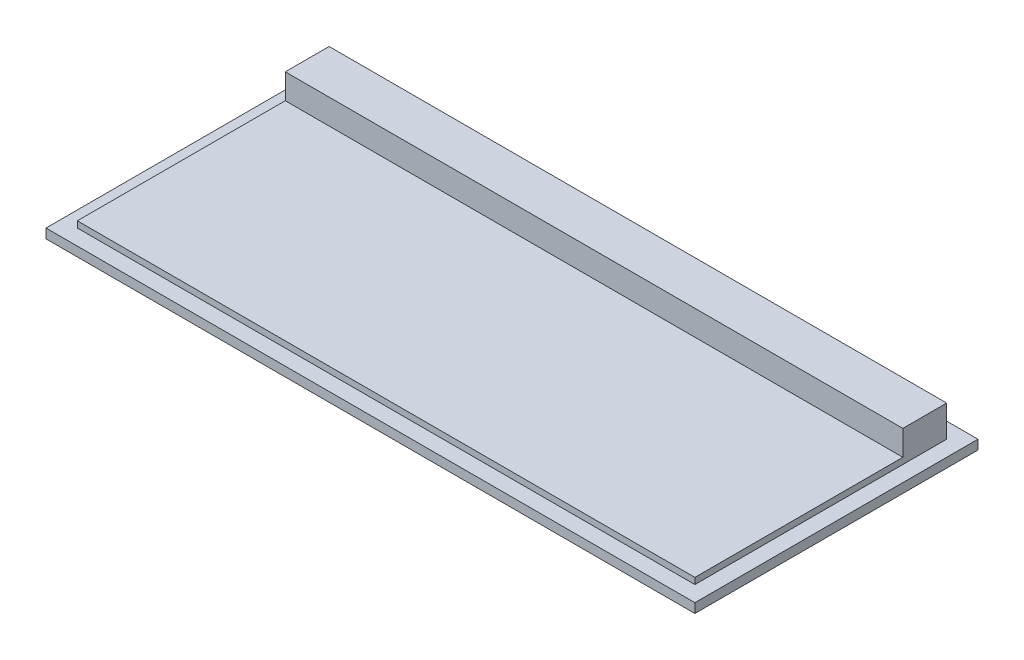
from build123d import *

# Parameters (mm, degrees)
SKETCH1_W           = 114.808
SKETCH1_H           = 3.81
BOSS_EXTRUDE1_DEPTH = 263.144
SKETCH2_W           = 250.444
SKETCH2_H           = 102.108
BOSS_EXTRUDE2_DEPTH = 2.54
SKETCH3_W           = 17.78
SKETCH3_H           = 10.16
BOSS_EXTRUDE3_DEPTH = 250.444
SKETCH4_W           = 12.7
SKETCH4_H           = 7.62
SKETCH4_W_2         = 11.176
SKETCH4_H_2         = 2.20281073
CUT_EXTRUDE2_DEPTH  = 12.7
SKETCH6_W           = 9.581222359
SKETCH6_H           = 1.422212694
BOSS_EXTRUDE4_DEPTH = 0.254
BOSS_EXTRUDE5_DEPTH = 1.27


with BuildPart() as part:
    # Sketch1 → Boss-Extrude1 (new body)
    with BuildSketch(Plane(origin=(0, 0, 0), x_dir=(0, 0, -1), z_dir=(1, 0, 0))):
        with Locations((57.404, 1.905)):
            Rectangle(SKETCH1_W, SKETCH1_H)
    extrude(amount=BOSS_EXTRUDE1_DEPTH)

    # Sketch2 → Boss-Extrude2 (add)
    with BuildSketch(Plane(origin=(0, 3.81, 0), x_dir=(1, 0, 0), z_dir=(0, 1, 0))):
        with Locations((131.572, 57.404)):
            Rectangle(SKETCH2_W, SKETCH2_H)
    extrude(amount=BOSS_EXTRUDE2_DEPTH)

    # Sketch3 → Boss-Extrude3 (add)
    with BuildSketch(Plane.ZY.offset(-6.35)):
        with Locations((-99.568, 11.43)):
            Rectangle(SKETCH3_W, SKETCH3_H)
    extrude(amount=-BOSS_EXTRUDE3_DEPTH)

    # Sketch4 → Cut-Extrude2 (cut)
    with BuildSketch(Plane.ZY.offset(-6.35)):
        with Locations((-99.568, 10.16)):
            Rectangle(SKETCH4_W, SKETCH4_H)
        with Locations((-99.568, 8.213405365)):
            Rectangle(SKETCH4_W_2, SKETCH4_H_2, mode=Mode.SUBTRACT)
    extrude(amount=-CUT_EXTRUDE2_DEPTH, mode=Mode.SUBTRACT)

    # Sketch6 → Boss-Extrude4 (add)
    with BuildSketch(Plane(origin=(0, 9.31481073, 0), x_dir=(1, 0, 0), z_dir=(0, 1, 0))):
        with Locations((12.657964299, 99.7444563)):
            Rectangle(SKETCH6_W, SKETCH6_H)
        with Locations((12.657964299, 102.5384563)):
            Rectangle(SKETCH6_W, SKETCH6_H)
        with Locations((12.657964299, 96.9504563)):
            Rectangle(SKETCH6_W, SKETCH6_H)
    extrude(amount=BOSS_EXTRUDE4_DEPTH)

    # Sketch7 → Boss-Extrude5 (add)
    with BuildSketch(Plane.XZ):
        with BuildLine():
            ThreePointArc((29.540645446, -103.040229749), (28.642619834, -103.412204137), (28.270645446, -104.310229749))
            Line((28.270645446, -104.310229749), (28.270645446, -109.036079669))
            ThreePointArc((28.270645446, -109.036079669), (28.642619834, -109.934105281), (29.540645446, -110.306079669))
            Line((29.540645446, -110.306079669), (41.281798737, -110.306079669))
            ThreePointArc((41.281798737, -110.306079669), (42.179824349, -109.934105281), (42.551798737, -109.036079669))
            Line((42.551798737, -109.036079669), (42.551798737, -104.310229749))
            ThreePointArc((42.551798737, -104.310229749), (42.179824349, -103.412204137), (41.281798737, -103.040229749))
            Line((41.281798737, -103.040229749), (29.540645446, -103.040229749))
        make_face()
        with BuildLine():
            Line((23.501798737, -103.040229749), (11.760645446, -103.040229749))
            ThreePointArc((11.760645446, -103.040229749), (10.862619834, -103.412204137), (10.490645446, -104.310229749))
            Line((10.490645446, -104.310229749), (10.490645446, -109.036079669))
            ThreePointArc((10.490645446, -109.036079669), (10.862619834, -109.934105281), (11.760645446, -110.306079669))
            Line((11.760645446, -110.306079669), (23.501798737, -110.306079669))
            ThreePointArc((23.501798737, -110.306079669), (24.399824349, -109.934105281), (24.771798737, -109.036079669))
            Line((24.771798737, -109.036079669), (24.771798737, -104.310229749))
            ThreePointArc((24.771798737, -104.310229749), (24.399824349, -103.412204137), (23.501798737, -103.040229749))
        make_face()
        with BuildLine():
            ThreePointArc((47.320645446, -103.040229749), (46.422619834, -103.412204137), (46.050645446, -104.310229749))
            Line((46.050645446, -104.310229749), (46.050645446, -109.036079669))
            ThreePointArc((46.050645446, -109.036079669), (46.422619834, -109.934105281), (47.320645446, -110.306079669))
            Line((47.320645446, -110.306079669), (59.061798737, -110.306079669))
            ThreePointArc((59.061798737, -110.306079669), (59.959824349, -109.934105281), (60.331798737, -109.036079669))
            Line((60.331798737, -109.036079669), (60.331798737, -104.310229749))
            ThreePointArc((60.331798737, -104.310229749), (59.959824349, -103.412204137), (59.061798737, -103.040229749))
            Line((59.061798737, -103.040229749), (47.320645446, -103.040229749))
        make_face()
        with BuildLine():
            ThreePointArc((65.100645446, -103.040229749), (64.202619834, -103.412204137), (63.830645446, -104.310229749))
            Line((63.830645446, -104.310229749), (63.830645446, -109.036079669))
            ThreePointArc((63.830645446, -109.036079669), (64.202619834, -109.934105281), (65.100645446, -110.306079669))
            Line((65.100645446, -110.306079669), (76.841798737, -110.306079669))
            ThreePointArc((76.841798737, -110.306079669), (77.739824349, -109.934105281), (78.111798737, -109.036079669))
            Line((78.111798737, -109.036079669), (78.111798737, -104.310229749))
            ThreePointArc((78.111798737, -104.310229749), (77.739824349, -103.412204137), (76.841798737, -103.040229749))
            Line((76.841798737, -103.040229749), (65.100645446, -103.040229749))
        make_face()
        with BuildLine():
            ThreePointArc((82.880645446, -103.040229749), (81.982619834, -103.412204137), (81.610645446, -104.310229749))
            Line((81.610645446, -104.310229749), (81.610645446, -109.036079669))
            ThreePointArc((81.610645446, -109.036079669), (81.982619834, -109.934105281), (82.880645446, -110.306079669))
            Line((82.880645446, -110.306079669), (94.621798737, -110.306079669))
            ThreePointArc((94.621798737, -110.306079669), (95.519824349, -109.934105281), (95.891798737, -109.036079669))
            Line((95.891798737, -109.036079669), (95.891798737, -104.310229749))
            ThreePointArc((95.891798737, -104.310229749), (95.519824349, -103.412204137), (94.621798737, -103.040229749))
            Line((94.621798737, -103.040229749), (82.880645446, -103.040229749))
        make_face()
        with BuildLine():
            ThreePointArc((100.660645446, -103.040229749), (99.762619834, -103.412204137), (99.390645446, -104.310229749))
            Line((99.390645446, -104.310229749), (99.390645446, -109.036079669))
            ThreePointArc((99.390645446, -109.036079669), (99.762619834, -109.934105281), (100.660645446, -110.306079669))
            Line((100.660645446, -110.306079669), (112.401798737, -110.306079669))
            ThreePointArc((112.401798737, -110.306079669), (113.299824349, -109.934105281), (113.671798737, -109.036079669))
            Line((113.671798737, -109.036079669), (113.671798737, -104.310229749))
            ThreePointArc((113.671798737, -104.310229749), (113.299824349, -103.412204137), (112.401798737, -103.040229749))
            Line((112.401798737, -103.040229749), (100.660645446, -103.040229749))
        make_face()
        with BuildLine():
            ThreePointArc((118.440645446, -103.040229749), (117.542619834, -103.412204137), (117.170645446, -104.310229749))
            Line((117.170645446, -104.310229749), (117.170645446, -109.036079669))
            ThreePointArc((117.170645446, -109.036079669), (117.542619834, -109.934105281), (118.440645446, -110.306079669))
            Line((118.440645446, -110.306079669), (130.181798737, -110.306079669))
            ThreePointArc((130.181798737, -110.306079669), (131.079824349, -109.934105281), (131.451798737, -109.036079669))
            Line((131.451798737, -109.036079669), (131.451798737, -104.310229749))
            ThreePointArc((131.451798737, -104.310229749), (131.079824349, -103.412204137), (130.181798737, -103.040229749))
            Line((130.181798737, -103.040229749), (118.440645446, -103.040229749))
        make_face()
        with BuildLine():
            ThreePointArc((136.220645446, -103.040229749), (135.322619834, -103.412204137), (134.950645446, -104.310229749))
            Line((134.950645446, -104.310229749), (134.950645446, -109.036079669))
            ThreePointArc((134.950645446, -109.036079669), (135.322619834, -109.934105281), (136.220645446, -110.306079669))
            Line((136.220645446, -110.306079669), (147.961798737, -110.306079669))
            ThreePointArc((147.961798737, -110.306079669), (148.859824349, -109.934105281), (149.231798737, -109.036079669))
            Line((149.231798737, -109.036079669), (149.231798737, -104.310229749))
            ThreePointArc((149.231798737, -104.310229749), (148.859824349, -103.412204137), (147.961798737, -103.040229749))
            Line((147.961798737, -103.040229749), (136.220645446, -103.040229749))
        make_face()
        with BuildLine():
            ThreePointArc((154.000645446, -103.040229749), (153.102619834, -103.412204137), (152.730645446, -104.310229749))
            Line((152.730645446, -104.310229749), (152.730645446, -109.036079669))
            ThreePointArc((152.730645446, -109.036079669), (153.102619834, -109.934105281), (154.000645446, -110.306079669))
            Line((154.000645446, -110.306079669), (165.741798737, -110.306079669))
            ThreePointArc((165.741798737, -110.306079669), (166.639824349, -109.934105281), (167.011798737, -109.036079669))
            Line((167.011798737, -109.036079669), (167.011798737, -104.310229749))
            ThreePointArc((167.011798737, -104.310229749), (166.639824349, -103.412204137), (165.741798737, -103.040229749))
            Line((165.741798737, -103.040229749), (154.000645446, -103.040229749))
        make_face()
        with BuildLine():
            ThreePointArc((171.780645446, -103.040229749), (170.882619834, -103.412204137), (170.510645446, -104.310229749))
            Line((170.510645446, -104.310229749), (170.510645446, -109.036079669))
            ThreePointArc((170.510645446, -109.036079669), (170.882619834, -109.934105281), (171.780645446, -110.306079669))
            Line((171.780645446, -110.306079669), (183.521798737, -110.306079669))
            ThreePointArc((183.521798737, -110.306079669), (184.419824349, -109.934105281), (184.791798737, -109.036079669))
            Line((184.791798737, -109.036079669), (184.791798737, -104.310229749))
            ThreePointArc((184.791798737, -104.310229749), (184.419824349, -103.412204137), (183.521798737, -103.040229749))
            Line((183.521798737, -103.040229749), (171.780645446, -103.040229749))
        make_face()
        with BuildLine():
            ThreePointArc((189.560645446, -103.040229749), (188.662619834, -103.412204137), (188.290645446, -104.310229749))
            Line((188.290645446, -104.310229749), (188.290645446, -109.036079669))
            ThreePointArc((188.290645446, -109.036079669), (188.662619834, -109.934105281), (189.560645446, -110.306079669))
            Line((189.560645446, -110.306079669), (201.301798737, -110.306079669))
            ThreePointArc((201.301798737, -110.306079669), (202.199824349, -109.934105281), (202.571798737, -109.036079669))
            Line((202.571798737, -109.036079669), (202.571798737, -104.310229749))
            ThreePointArc((202.571798737, -104.310229749), (202.199824349, -103.412204137), (201.301798737, -103.040229749))
            Line((201.301798737, -103.040229749), (189.560645446, -103.040229749))
        make_face()
        with BuildLine():
            ThreePointArc((207.340645446, -103.040229749), (206.442619834, -103.412204137), (206.070645446, -104.310229749))
            Line((206.070645446, -104.310229749), (206.070645446, -109.036079669))
            ThreePointArc((206.070645446, -109.036079669), (206.442619834, -109.934105281), (207.340645446, -110.306079669))
            Line((207.340645446, -110.306079669), (219.081798737, -110.306079669))
            ThreePointArc((219.081798737, -110.306079669), (219.979824349, -109.934105281), (220.351798737, -109.036079669))
            Line((220.351798737, -109.036079669), (220.351798737, -104.310229749))
            ThreePointArc((220.351798737, -104.310229749), (219.979824349, -103.412204137), (219.081798737, -103.040229749))
            Line((219.081798737, -103.040229749), (207.340645446, -103.040229749))
        make_face()
        with BuildLine():
            ThreePointArc((225.120645446, -103.040229749), (224.222619834, -103.412204137), (223.850645446, -104.310229749))
            Line((223.850645446, -104.310229749), (223.850645446, -109.036079669))
            ThreePointArc((223.850645446, -109.036079669), (224.222619834, -109.934105281), (225.120645446, -110.306079669))
            Line((225.120645446, -110.306079669), (236.861798737, -110.306079669))
            ThreePointArc((236.861798737, -110.306079669), (237.759824349, -109.934105281), (238.131798737, -109.036079669))
            Line((238.131798737, -109.036079669), (238.131798737, -104.310229749))
            ThreePointArc((238.131798737, -104.310229749), (237.759824349, -103.412204137), (236.861798737, -103.040229749))
            Line((236.861798737, -103.040229749), (225.120645446, -103.040229749))
        make_face()
        with BuildLine():
            ThreePointArc((242.900645446, -103.040229749), (242.002619834, -103.412204137), (241.630645446, -104.310229749))
            Line((241.630645446, -104.310229749), (241.630645446, -109.036079669))
            ThreePointArc((241.630645446, -109.036079669), (242.002619834, -109.934105281), (242.900645446, -110.306079669))
            Line((242.900645446, -110.306079669), (254.641798737, -110.306079669))
            ThreePointArc((254.641798737, -110.306079669), (255.539824349, -109.934105281), (255.911798737, -109.036079669))
            Line((255.911798737, -109.036079669), (255.911798737, -104.310229749))
            ThreePointArc((255.911798737, -104.310229749), (255.539824349, -103.412204137), (254.641798737, -103.040229749))
            Line((254.641798737, -103.040229749), (242.900645446, -103.040229749))
        make_face()
        with BuildLine():
            Line((28.208557613, -88.183269475), (28.208557613, -98.079200192))
            ThreePointArc((28.208557613, -98.079200192), (28.580532001, -98.977225804), (29.478557613, -99.349200192))
            Line((29.478557613, -99.349200192), (41.219710905, -99.349200192))
            ThreePointArc((41.219710905, -99.349200192), (42.117736517, -98.977225804), (42.489710905, -98.079200192))
            Line((42.489710905, -98.079200192), (42.489710905, -88.183269475))
            ThreePointArc((42.489710905, -88.183269475), (42.117736517, -87.285243863), (41.219710905, -86.913269475))
            Line((41.219710905, -86.913269475), (29.478557613, -86.913269475))
            ThreePointArc((29.478557613, -86.913269475), (28.580532001, -87.285243863), (28.208557613, -88.183269475))
        make_face()
        with BuildLine():
            ThreePointArc((10.490645446, -98.079200192), (10.862619834, -98.977225804), (11.760645446, -99.349200192))
            Line((11.760645446, -99.349200192), (23.501798737, -99.349200192))
            ThreePointArc((23.501798737, -99.349200192), (24.399824349, -98.977225804), (24.771798737, -98.079200192))
            Line((24.771798737, -98.079200192), (24.771798737, -88.183269475))
            ThreePointArc((24.771798737, -88.183269475), (24.399824349, -87.285243863), (23.501798737, -86.913269475))
            Line((23.501798737, -86.913269475), (11.760645446, -86.913269475))
            ThreePointArc((11.760645446, -86.913269475), (10.862619834, -87.285243863), (10.490645446, -88.183269475))
            Line((10.490645446, -88.183269475), (10.490645446, -98.079200192))
        make_face()
        with BuildLine():
            Line((45.926469781, -88.183269475), (45.926469781, -98.079200192))
            ThreePointArc((45.926469781, -98.079200192), (46.298444169, -98.977225804), (47.196469781, -99.349200192))
            Line((47.196469781, -99.349200192), (58.937623073, -99.349200192))
            ThreePointArc((58.937623073, -99.349200192), (59.835648685, -98.977225804), (60.207623073, -98.079200192))
            Line((60.207623073, -98.079200192), (60.207623073, -88.183269475))
            ThreePointArc((60.207623073, -88.183269475), (59.835648685, -87.285243863), (58.937623073, -86.913269475))
            Line((58.937623073, -86.913269475), (47.196469781, -86.913269475))
            ThreePointArc((47.196469781, -86.913269475), (46.298444169, -87.285243863), (45.926469781, -88.183269475))
        make_face()
        with BuildLine():
            Line((63.644381949, -88.183269475), (63.644381949, -98.079200192))
            ThreePointArc((63.644381949, -98.079200192), (64.016356336, -98.977225804), (64.914381949, -99.349200192))
            Line((64.914381949, -99.349200192), (76.65553524, -99.349200192))
            ThreePointArc((76.65553524, -99.349200192), (77.553560852, -98.977225804), (77.92553524, -98.079200192))
            Line((77.92553524, -98.079200192), (77.92553524, -88.183269475))
            ThreePointArc((77.92553524, -88.183269475), (77.553560852, -87.285243863), (76.65553524, -86.913269475))
            Line((76.65553524, -86.913269475), (64.914381949, -86.913269475))
            ThreePointArc((64.914381949, -86.913269475), (64.016356336, -87.285243863), (63.644381949, -88.183269475))
        make_face()
        with BuildLine():
            Line((81.362294116, -88.183269475), (81.362294116, -98.079200192))
            ThreePointArc((81.362294116, -98.079200192), (81.734268504, -98.977225804), (82.632294116, -99.349200192))
            Line((82.632294116, -99.349200192), (94.373447408, -99.349200192))
            ThreePointArc((94.373447408, -99.349200192), (95.27147302, -98.977225804), (95.643447408, -98.079200192))
            Line((95.643447408, -98.079200192), (95.643447408, -88.183269475))
            ThreePointArc((95.643447408, -88.183269475), (95.27147302, -87.285243863), (94.373447408, -86.913269475))
            Line((94.373447408, -86.913269475), (82.632294116, -86.913269475))
            ThreePointArc((82.632294116, -86.913269475), (81.734268504, -87.285243863), (81.362294116, -88.183269475))
        make_face()
        with BuildLine():
            Line((99.080206284, -88.183269475), (99.080206284, -98.079200192))
            ThreePointArc((99.080206284, -98.079200192), (99.452180672, -98.977225804), (100.350206284, -99.349200192))
            Line((100.350206284, -99.349200192), (112.091359576, -99.349200192))
            ThreePointArc((112.091359576, -99.349200192), (112.989385188, -98.977225804), (113.361359576, -98.079200192))
            Line((113.361359576, -98.079200192), (113.361359576, -88.183269475))
            ThreePointArc((113.361359576, -88.183269475), (112.989385188, -87.285243863), (112.091359576, -86.913269475))
            Line((112.091359576, -86.913269475), (100.350206284, -86.913269475))
            ThreePointArc((100.350206284, -86.913269475), (99.452180672, -87.285243863), (99.080206284, -88.183269475))
        make_face()
        with BuildLine():
            Line((116.798118452, -88.183269475), (116.798118452, -98.079200192))
            ThreePointArc((116.798118452, -98.079200192), (117.170092839, -98.977225804), (118.068118452, -99.349200192))
            Line((118.068118452, -99.349200192), (129.809271743, -99.349200192))
            ThreePointArc((129.809271743, -99.349200192), (130.707297355, -98.977225804), (131.079271743, -98.079200192))
            Line((131.079271743, -98.079200192), (131.079271743, -88.183269475))
            ThreePointArc((131.079271743, -88.183269475), (130.707297355, -87.285243863), (129.809271743, -86.913269475))
            Line((129.809271743, -86.913269475), (118.068118452, -86.913269475))
            ThreePointArc((118.068118452, -86.913269475), (117.170092839, -87.285243863), (116.798118452, -88.183269475))
        make_face()
        with BuildLine():
            Line((134.516030619, -88.183269475), (134.516030619, -98.079200192))
            ThreePointArc((134.516030619, -98.079200192), (134.888005007, -98.977225804), (135.786030619, -99.349200192))
            Line((135.786030619, -99.349200192), (147.527183911, -99.349200192))
            ThreePointArc((147.527183911, -99.349200192), (148.425209523, -98.977225804), (148.797183911, -98.079200192))
            Line((148.797183911, -98.079200192), (148.797183911, -88.183269475))
            ThreePointArc((148.797183911, -88.183269475), (148.425209523, -87.285243863), (147.527183911, -86.913269475))
            Line((147.527183911, -86.913269475), (135.786030619, -86.913269475))
            ThreePointArc((135.786030619, -86.913269475), (134.888005007, -87.285243863), (134.516030619, -88.183269475))
        make_face()
        with BuildLine():
            Line((152.233942787, -88.183269475), (152.233942787, -98.079200192))
            ThreePointArc((152.233942787, -98.079200192), (152.605917175, -98.977225804), (153.503942787, -99.349200192))
            Line((153.503942787, -99.349200192), (165.245096079, -99.349200192))
            ThreePointArc((165.245096079, -99.349200192), (166.143121691, -98.977225804), (166.515096079, -98.079200192))
            Line((166.515096079, -98.079200192), (166.515096079, -88.183269475))
            ThreePointArc((166.515096079, -88.183269475), (166.143121691, -87.285243863), (165.245096079, -86.913269475))
            Line((165.245096079, -86.913269475), (153.503942787, -86.913269475))
            ThreePointArc((153.503942787, -86.913269475), (152.605917175, -87.285243863), (152.233942787, -88.183269475))
        make_face()
        with BuildLine():
            Line((169.951854954, -88.183269475), (169.951854954, -98.079200192))
            ThreePointArc((169.951854954, -98.079200192), (170.323829342, -98.977225804), (171.221854954, -99.349200192))
            Line((171.221854954, -99.349200192), (182.963008246, -99.349200192))
            ThreePointArc((182.963008246, -99.349200192), (183.861033858, -98.977225804), (184.233008246, -98.079200192))
            Line((184.233008246, -98.079200192), (184.233008246, -88.183269475))
            ThreePointArc((184.233008246, -88.183269475), (183.861033858, -87.285243863), (182.963008246, -86.913269475))
            Line((182.963008246, -86.913269475), (171.221854954, -86.913269475))
            ThreePointArc((171.221854954, -86.913269475), (170.323829342, -87.285243863), (169.951854954, -88.183269475))
        make_face()
        with BuildLine():
            Line((187.669767122, -88.183269475), (187.669767122, -98.079200192))
            ThreePointArc((187.669767122, -98.079200192), (188.04174151, -98.977225804), (188.939767122, -99.349200192))
            Line((188.939767122, -99.349200192), (200.680920414, -99.349200192))
            ThreePointArc((200.680920414, -99.349200192), (201.578946026, -98.977225804), (201.950920414, -98.079200192))
            Line((201.950920414, -98.079200192), (201.950920414, -88.183269475))
            ThreePointArc((201.950920414, -88.183269475), (201.578946026, -87.285243863), (200.680920414, -86.913269475))
            Line((200.680920414, -86.913269475), (188.939767122, -86.913269475))
            ThreePointArc((188.939767122, -86.913269475), (188.04174151, -87.285243863), (187.669767122, -88.183269475))
        make_face()
        with BuildLine():
            Line((205.38767929, -88.183269475), (205.38767929, -98.079200192))
            ThreePointArc((205.38767929, -98.079200192), (205.759653678, -98.977225804), (206.65767929, -99.349200192))
            Line((206.65767929, -99.349200192), (218.398832581, -99.349200192))
            ThreePointArc((218.398832581, -99.349200192), (219.296858194, -98.977225804), (219.668832581, -98.079200192))
            Line((219.668832581, -98.079200192), (219.668832581, -88.183269475))
            ThreePointArc((219.668832581, -88.183269475), (219.296858194, -87.285243863), (218.398832581, -86.913269475))
            Line((218.398832581, -86.913269475), (206.65767929, -86.913269475))
            ThreePointArc((206.65767929, -86.913269475), (205.759653678, -87.285243863), (205.38767929, -88.183269475))
        make_face()
        with BuildLine():
            Line((223.105591457, -88.183269475), (223.105591457, -98.079200192))
            ThreePointArc((223.105591457, -98.079200192), (223.477565845, -98.977225804), (224.375591457, -99.349200192))
            Line((224.375591457, -99.349200192), (236.116744749, -99.349200192))
            ThreePointArc((236.116744749, -99.349200192), (237.014770361, -98.977225804), (237.386744749, -98.079200192))
            Line((237.386744749, -98.079200192), (237.386744749, -88.183269475))
            ThreePointArc((237.386744749, -88.183269475), (237.014770361, -87.285243863), (236.116744749, -86.913269475))
            Line((236.116744749, -86.913269475), (224.375591457, -86.913269475))
            ThreePointArc((224.375591457, -86.913269475), (223.477565845, -87.285243863), (223.105591457, -88.183269475))
        make_face()
        with BuildLine():
            Line((240.823503625, -88.183269475), (240.823503625, -98.079200192))
            ThreePointArc((240.823503625, -98.079200192), (241.195478013, -98.977225804), (242.093503625, -99.349200192))
            Line((242.093503625, -99.349200192), (253.834656917, -99.349200192))
            ThreePointArc((253.834656917, -99.349200192), (254.732682529, -98.977225804), (255.104656917, -98.079200192))
            Line((255.104656917, -98.079200192), (255.104656917, -88.183269475))
            ThreePointArc((255.104656917, -88.183269475), (254.732682529, -87.285243863), (253.834656917, -86.913269475))
            Line((253.834656917, -86.913269475), (242.093503625, -86.913269475))
            ThreePointArc((242.093503625, -86.913269475), (241.195478013, -87.285243863), (240.823503625, -88.183269475))
        make_face()
        with BuildLine():
            Line((28.208557613, -72.943269475), (28.208557613, -82.839200192))
            ThreePointArc((28.208557613, -82.839200192), (28.580532001, -83.737225804), (29.478557613, -84.109200192))
            Line((29.478557613, -84.109200192), (41.219710905, -84.109200192))
            ThreePointArc((41.219710905, -84.109200192), (42.117736517, -83.737225804), (42.489710905, -82.839200192))
            Line((42.489710905, -82.839200192), (42.489710905, -72.943269475))
            ThreePointArc((42.489710905, -72.943269475), (42.117736517, -72.045243863), (41.219710905, -71.673269475))
            Line((41.219710905, -71.673269475), (29.478557613, -71.673269475))
            ThreePointArc((29.478557613, -71.673269475), (28.580532001, -72.045243863), (28.208557613, -72.943269475))
        make_face()
        with BuildLine():
            Line((45.926469781, -72.943269475), (45.926469781, -82.839200192))
            ThreePointArc((45.926469781, -82.839200192), (46.298444169, -83.737225804), (47.196469781, -84.109200192))
            Line((47.196469781, -84.109200192), (58.937623073, -84.109200192))
            ThreePointArc((58.937623073, -84.109200192), (59.835648685, -83.737225804), (60.207623073, -82.839200192))
            Line((60.207623073, -82.839200192), (60.207623073, -72.943269475))
            ThreePointArc((60.207623073, -72.943269475), (59.835648685, -72.045243863), (58.937623073, -71.673269475))
            Line((58.937623073, -71.673269475), (47.196469781, -71.673269475))
            ThreePointArc((47.196469781, -71.673269475), (46.298444169, -72.045243863), (45.926469781, -72.943269475))
        make_face()
        with BuildLine():
            Line((63.644381949, -72.943269475), (63.644381949, -82.839200192))
            ThreePointArc((63.644381949, -82.839200192), (64.016356336, -83.737225804), (64.914381949, -84.109200192))
            Line((64.914381949, -84.109200192), (76.65553524, -84.109200192))
            ThreePointArc((76.65553524, -84.109200192), (77.553560852, -83.737225804), (77.92553524, -82.839200192))
            Line((77.92553524, -82.839200192), (77.92553524, -72.943269475))
            ThreePointArc((77.92553524, -72.943269475), (77.553560852, -72.045243863), (76.65553524, -71.673269475))
            Line((76.65553524, -71.673269475), (64.914381949, -71.673269475))
            ThreePointArc((64.914381949, -71.673269475), (64.016356336, -72.045243863), (63.644381949, -72.943269475))
        make_face()
        with BuildLine():
            Line((81.362294116, -72.943269475), (81.362294116, -82.839200192))
            ThreePointArc((81.362294116, -82.839200192), (81.734268504, -83.737225804), (82.632294116, -84.109200192))
            Line((82.632294116, -84.109200192), (94.373447408, -84.109200192))
            ThreePointArc((94.373447408, -84.109200192), (95.27147302, -83.737225804), (95.643447408, -82.839200192))
            Line((95.643447408, -82.839200192), (95.643447408, -72.943269475))
            ThreePointArc((95.643447408, -72.943269475), (95.27147302, -72.045243863), (94.373447408, -71.673269475))
            Line((94.373447408, -71.673269475), (82.632294116, -71.673269475))
            ThreePointArc((82.632294116, -71.673269475), (81.734268504, -72.045243863), (81.362294116, -72.943269475))
        make_face()
        with BuildLine():
            Line((99.080206284, -72.943269475), (99.080206284, -82.839200192))
            ThreePointArc((99.080206284, -82.839200192), (99.452180672, -83.737225804), (100.350206284, -84.109200192))
            Line((100.350206284, -84.109200192), (112.091359576, -84.109200192))
            ThreePointArc((112.091359576, -84.109200192), (112.989385188, -83.737225804), (113.361359576, -82.839200192))
            Line((113.361359576, -82.839200192), (113.361359576, -72.943269475))
            ThreePointArc((113.361359576, -72.943269475), (112.989385188, -72.045243863), (112.091359576, -71.673269475))
            Line((112.091359576, -71.673269475), (100.350206284, -71.673269475))
            ThreePointArc((100.350206284, -71.673269475), (99.452180672, -72.045243863), (99.080206284, -72.943269475))
        make_face()
        with BuildLine():
            Line((116.798118452, -72.943269475), (116.798118452, -82.839200192))
            ThreePointArc((116.798118452, -82.839200192), (117.170092839, -83.737225804), (118.068118452, -84.109200192))
            Line((118.068118452, -84.109200192), (129.809271743, -84.109200192))
            ThreePointArc((129.809271743, -84.109200192), (130.707297355, -83.737225804), (131.079271743, -82.839200192))
            Line((131.079271743, -82.839200192), (131.079271743, -72.943269475))
            ThreePointArc((131.079271743, -72.943269475), (130.707297355, -72.045243863), (129.809271743, -71.673269475))
            Line((129.809271743, -71.673269475), (118.068118452, -71.673269475))
            ThreePointArc((118.068118452, -71.673269475), (117.170092839, -72.045243863), (116.798118452, -72.943269475))
        make_face()
        with BuildLine():
            Line((134.516030619, -72.943269475), (134.516030619, -82.839200192))
            ThreePointArc((134.516030619, -82.839200192), (134.888005007, -83.737225804), (135.786030619, -84.109200192))
            Line((135.786030619, -84.109200192), (147.527183911, -84.109200192))
            ThreePointArc((147.527183911, -84.109200192), (148.425209523, -83.737225804), (148.797183911, -82.839200192))
            Line((148.797183911, -82.839200192), (148.797183911, -72.943269475))
            ThreePointArc((148.797183911, -72.943269475), (148.425209523, -72.045243863), (147.527183911, -71.673269475))
            Line((147.527183911, -71.673269475), (135.786030619, -71.673269475))
            ThreePointArc((135.786030619, -71.673269475), (134.888005007, -72.045243863), (134.516030619, -72.943269475))
        make_face()
        with BuildLine():
            Line((152.233942787, -72.943269475), (152.233942787, -82.839200192))
            ThreePointArc((152.233942787, -82.839200192), (152.605917175, -83.737225804), (153.503942787, -84.109200192))
            Line((153.503942787, -84.109200192), (165.245096079, -84.109200192))
            ThreePointArc((165.245096079, -84.109200192), (166.143121691, -83.737225804), (166.515096079, -82.839200192))
            Line((166.515096079, -82.839200192), (166.515096079, -72.943269475))
            ThreePointArc((166.515096079, -72.943269475), (166.143121691, -72.045243863), (165.245096079, -71.673269475))
            Line((165.245096079, -71.673269475), (153.503942787, -71.673269475))
            ThreePointArc((153.503942787, -71.673269475), (152.605917175, -72.045243863), (152.233942787, -72.943269475))
        make_face()
        with BuildLine():
            Line((169.951854954, -72.943269475), (169.951854954, -82.839200192))
            ThreePointArc((169.951854954, -82.839200192), (170.323829342, -83.737225804), (171.221854954, -84.109200192))
            Line((171.221854954, -84.109200192), (182.963008246, -84.109200192))
            ThreePointArc((182.963008246, -84.109200192), (183.861033858, -83.737225804), (184.233008246, -82.839200192))
            Line((184.233008246, -82.839200192), (184.233008246, -72.943269475))
            ThreePointArc((184.233008246, -72.943269475), (183.861033858, -72.045243863), (182.963008246, -71.673269475))
            Line((182.963008246, -71.673269475), (171.221854954, -71.673269475))
            ThreePointArc((171.221854954, -71.673269475), (170.323829342, -72.045243863), (169.951854954, -72.943269475))
        make_face()
        with BuildLine():
            Line((187.669767122, -72.943269475), (187.669767122, -82.839200192))
            ThreePointArc((187.669767122, -82.839200192), (188.04174151, -83.737225804), (188.939767122, -84.109200192))
            Line((188.939767122, -84.109200192), (200.680920414, -84.109200192))
            ThreePointArc((200.680920414, -84.109200192), (201.578946026, -83.737225804), (201.950920414, -82.839200192))
            Line((201.950920414, -82.839200192), (201.950920414, -72.943269475))
            ThreePointArc((201.950920414, -72.943269475), (201.578946026, -72.045243863), (200.680920414, -71.673269475))
            Line((200.680920414, -71.673269475), (188.939767122, -71.673269475))
            ThreePointArc((188.939767122, -71.673269475), (188.04174151, -72.045243863), (187.669767122, -72.943269475))
        make_face()
        with BuildLine():
            Line((205.38767929, -72.943269475), (205.38767929, -82.839200192))
            ThreePointArc((205.38767929, -82.839200192), (205.759653678, -83.737225804), (206.65767929, -84.109200192))
            Line((206.65767929, -84.109200192), (218.398832581, -84.109200192))
            ThreePointArc((218.398832581, -84.109200192), (219.296858194, -83.737225804), (219.668832581, -82.839200192))
            Line((219.668832581, -82.839200192), (219.668832581, -72.943269475))
            ThreePointArc((219.668832581, -72.943269475), (219.296858194, -72.045243863), (218.398832581, -71.673269475))
            Line((218.398832581, -71.673269475), (206.65767929, -71.673269475))
            ThreePointArc((206.65767929, -71.673269475), (205.759653678, -72.045243863), (205.38767929, -72.943269475))
        make_face()
        with BuildLine():
            Line((223.105591457, -72.943269475), (223.105591457, -82.839200192))
            ThreePointArc((223.105591457, -82.839200192), (223.477565845, -83.737225804), (224.375591457, -84.109200192))
            Line((224.375591457, -84.109200192), (236.116744749, -84.109200192))
            ThreePointArc((236.116744749, -84.109200192), (237.014770361, -83.737225804), (237.386744749, -82.839200192))
            Line((237.386744749, -82.839200192), (237.386744749, -72.943269475))
            ThreePointArc((237.386744749, -72.943269475), (237.014770361, -72.045243863), (236.116744749, -71.673269475))
            Line((236.116744749, -71.673269475), (224.375591457, -71.673269475))
            ThreePointArc((224.375591457, -71.673269475), (223.477565845, -72.045243863), (223.105591457, -72.943269475))
        make_face()
        with BuildLine():
            Line((240.823503625, -72.943269475), (240.823503625, -82.839200192))
            ThreePointArc((240.823503625, -82.839200192), (241.195478013, -83.737225804), (242.093503625, -84.109200192))
            Line((242.093503625, -84.109200192), (253.834656917, -84.109200192))
            ThreePointArc((253.834656917, -84.109200192), (254.732682529, -83.737225804), (255.104656917, -82.839200192))
            Line((255.104656917, -82.839200192), (255.104656917, -72.943269475))
            ThreePointArc((255.104656917, -72.943269475), (254.732682529, -72.045243863), (253.834656917, -71.673269475))
            Line((253.834656917, -71.673269475), (242.093503625, -71.673269475))
            ThreePointArc((242.093503625, -71.673269475), (241.195478013, -72.045243863), (240.823503625, -72.943269475))
        make_face()
        with BuildLine():
            Line((28.208557613, -57.703269475), (28.208557613, -67.599200192))
            ThreePointArc((28.208557613, -67.599200192), (28.580532001, -68.497225804), (29.478557613, -68.869200192))
            Line((29.478557613, -68.869200192), (41.219710905, -68.869200192))
            ThreePointArc((41.219710905, -68.869200192), (42.117736517, -68.497225804), (42.489710905, -67.599200192))
            Line((42.489710905, -67.599200192), (42.489710905, -57.703269475))
            ThreePointArc((42.489710905, -57.703269475), (42.117736517, -56.805243863), (41.219710905, -56.433269475))
            Line((41.219710905, -56.433269475), (29.478557613, -56.433269475))
            ThreePointArc((29.478557613, -56.433269475), (28.580532001, -56.805243863), (28.208557613, -57.703269475))
        make_face()
        with BuildLine():
            Line((45.926469781, -57.703269475), (45.926469781, -67.599200192))
            ThreePointArc((45.926469781, -67.599200192), (46.298444169, -68.497225804), (47.196469781, -68.869200192))
            Line((47.196469781, -68.869200192), (58.937623073, -68.869200192))
            ThreePointArc((58.937623073, -68.869200192), (59.835648685, -68.497225804), (60.207623073, -67.599200192))
            Line((60.207623073, -67.599200192), (60.207623073, -57.703269475))
            ThreePointArc((60.207623073, -57.703269475), (59.835648685, -56.805243863), (58.937623073, -56.433269475))
            Line((58.937623073, -56.433269475), (47.196469781, -56.433269475))
            ThreePointArc((47.196469781, -56.433269475), (46.298444169, -56.805243863), (45.926469781, -57.703269475))
        make_face()
        with BuildLine():
            Line((63.644381949, -57.703269475), (63.644381949, -67.599200192))
            ThreePointArc((63.644381949, -67.599200192), (64.016356336, -68.497225804), (64.914381949, -68.869200192))
            Line((64.914381949, -68.869200192), (76.65553524, -68.869200192))
            ThreePointArc((76.65553524, -68.869200192), (77.553560852, -68.497225804), (77.92553524, -67.599200192))
            Line((77.92553524, -67.599200192), (77.92553524, -57.703269475))
            ThreePointArc((77.92553524, -57.703269475), (77.553560852, -56.805243863), (76.65553524, -56.433269475))
            Line((76.65553524, -56.433269475), (64.914381949, -56.433269475))
            ThreePointArc((64.914381949, -56.433269475), (64.016356336, -56.805243863), (63.644381949, -57.703269475))
        make_face()
        with BuildLine():
            Line((81.362294116, -57.703269475), (81.362294116, -67.599200192))
            ThreePointArc((81.362294116, -67.599200192), (81.734268504, -68.497225804), (82.632294116, -68.869200192))
            Line((82.632294116, -68.869200192), (94.373447408, -68.869200192))
            ThreePointArc((94.373447408, -68.869200192), (95.27147302, -68.497225804), (95.643447408, -67.599200192))
            Line((95.643447408, -67.599200192), (95.643447408, -57.703269475))
            ThreePointArc((95.643447408, -57.703269475), (95.27147302, -56.805243863), (94.373447408, -56.433269475))
            Line((94.373447408, -56.433269475), (82.632294116, -56.433269475))
            ThreePointArc((82.632294116, -56.433269475), (81.734268504, -56.805243863), (81.362294116, -57.703269475))
        make_face()
        with BuildLine():
            Line((99.080206284, -57.703269475), (99.080206284, -67.599200192))
            ThreePointArc((99.080206284, -67.599200192), (99.452180672, -68.497225804), (100.350206284, -68.869200192))
            Line((100.350206284, -68.869200192), (112.091359576, -68.869200192))
            ThreePointArc((112.091359576, -68.869200192), (112.989385188, -68.497225804), (113.361359576, -67.599200192))
            Line((113.361359576, -67.599200192), (113.361359576, -57.703269475))
            ThreePointArc((113.361359576, -57.703269475), (112.989385188, -56.805243863), (112.091359576, -56.433269475))
            Line((112.091359576, -56.433269475), (100.350206284, -56.433269475))
            ThreePointArc((100.350206284, -56.433269475), (99.452180672, -56.805243863), (99.080206284, -57.703269475))
        make_face()
        with BuildLine():
            Line((116.798118452, -57.703269475), (116.798118452, -67.599200192))
            ThreePointArc((116.798118452, -67.599200192), (117.170092839, -68.497225804), (118.068118452, -68.869200192))
            Line((118.068118452, -68.869200192), (129.809271743, -68.869200192))
            ThreePointArc((129.809271743, -68.869200192), (130.707297355, -68.497225804), (131.079271743, -67.599200192))
            Line((131.079271743, -67.599200192), (131.079271743, -57.703269475))
            ThreePointArc((131.079271743, -57.703269475), (130.707297355, -56.805243863), (129.809271743, -56.433269475))
            Line((129.809271743, -56.433269475), (118.068118452, -56.433269475))
            ThreePointArc((118.068118452, -56.433269475), (117.170092839, -56.805243863), (116.798118452, -57.703269475))
        make_face()
        with BuildLine():
            Line((134.516030619, -57.703269475), (134.516030619, -67.599200192))
            ThreePointArc((134.516030619, -67.599200192), (134.888005007, -68.497225804), (135.786030619, -68.869200192))
            Line((135.786030619, -68.869200192), (147.527183911, -68.869200192))
            ThreePointArc((147.527183911, -68.869200192), (148.425209523, -68.497225804), (148.797183911, -67.599200192))
            Line((148.797183911, -67.599200192), (148.797183911, -57.703269475))
            ThreePointArc((148.797183911, -57.703269475), (148.425209523, -56.805243863), (147.527183911, -56.433269475))
            Line((147.527183911, -56.433269475), (135.786030619, -56.433269475))
            ThreePointArc((135.786030619, -56.433269475), (134.888005007, -56.805243863), (134.516030619, -57.703269475))
        make_face()
        with BuildLine():
            Line((152.233942787, -57.703269475), (152.233942787, -67.599200192))
            ThreePointArc((152.233942787, -67.599200192), (152.605917175, -68.497225804), (153.503942787, -68.869200192))
            Line((153.503942787, -68.869200192), (165.245096079, -68.869200192))
            ThreePointArc((165.245096079, -68.869200192), (166.143121691, -68.497225804), (166.515096079, -67.599200192))
            Line((166.515096079, -67.599200192), (166.515096079, -57.703269475))
            ThreePointArc((166.515096079, -57.703269475), (166.143121691, -56.805243863), (165.245096079, -56.433269475))
            Line((165.245096079, -56.433269475), (153.503942787, -56.433269475))
            ThreePointArc((153.503942787, -56.433269475), (152.605917175, -56.805243863), (152.233942787, -57.703269475))
        make_face()
        with BuildLine():
            Line((169.951854954, -57.703269475), (169.951854954, -67.599200192))
            ThreePointArc((169.951854954, -67.599200192), (170.323829342, -68.497225804), (171.221854954, -68.869200192))
            Line((171.221854954, -68.869200192), (182.963008246, -68.869200192))
            ThreePointArc((182.963008246, -68.869200192), (183.861033858, -68.497225804), (184.233008246, -67.599200192))
            Line((184.233008246, -67.599200192), (184.233008246, -57.703269475))
            ThreePointArc((184.233008246, -57.703269475), (183.861033858, -56.805243863), (182.963008246, -56.433269475))
            Line((182.963008246, -56.433269475), (171.221854954, -56.433269475))
            ThreePointArc((171.221854954, -56.433269475), (170.323829342, -56.805243863), (169.951854954, -57.703269475))
        make_face()
        with BuildLine():
            Line((187.669767122, -57.703269475), (187.669767122, -67.599200192))
            ThreePointArc((187.669767122, -67.599200192), (188.04174151, -68.497225804), (188.939767122, -68.869200192))
            Line((188.939767122, -68.869200192), (200.680920414, -68.869200192))
            ThreePointArc((200.680920414, -68.869200192), (201.578946026, -68.497225804), (201.950920414, -67.599200192))
            Line((201.950920414, -67.599200192), (201.950920414, -57.703269475))
            ThreePointArc((201.950920414, -57.703269475), (201.578946026, -56.805243863), (200.680920414, -56.433269475))
            Line((200.680920414, -56.433269475), (188.939767122, -56.433269475))
            ThreePointArc((188.939767122, -56.433269475), (188.04174151, -56.805243863), (187.669767122, -57.703269475))
        make_face()
        with BuildLine():
            Line((205.38767929, -57.703269475), (205.38767929, -67.599200192))
            ThreePointArc((205.38767929, -67.599200192), (205.759653678, -68.497225804), (206.65767929, -68.869200192))
            Line((206.65767929, -68.869200192), (218.398832581, -68.869200192))
            ThreePointArc((218.398832581, -68.869200192), (219.296858194, -68.497225804), (219.668832581, -67.599200192))
            Line((219.668832581, -67.599200192), (219.668832581, -57.703269475))
            ThreePointArc((219.668832581, -57.703269475), (219.296858194, -56.805243863), (218.398832581, -56.433269475))
            Line((218.398832581, -56.433269475), (206.65767929, -56.433269475))
            ThreePointArc((206.65767929, -56.433269475), (205.759653678, -56.805243863), (205.38767929, -57.703269475))
        make_face()
        with BuildLine():
            Line((223.105591457, -57.703269475), (223.105591457, -67.599200192))
            ThreePointArc((223.105591457, -67.599200192), (223.477565845, -68.497225804), (224.375591457, -68.869200192))
            Line((224.375591457, -68.869200192), (236.116744749, -68.869200192))
            ThreePointArc((236.116744749, -68.869200192), (237.014770361, -68.497225804), (237.386744749, -67.599200192))
            Line((237.386744749, -67.599200192), (237.386744749, -57.703269475))
            ThreePointArc((237.386744749, -57.703269475), (237.014770361, -56.805243863), (236.116744749, -56.433269475))
            Line((236.116744749, -56.433269475), (224.375591457, -56.433269475))
            ThreePointArc((224.375591457, -56.433269475), (223.477565845, -56.805243863), (223.105591457, -57.703269475))
        make_face()
        with BuildLine():
            Line((240.823503625, -57.703269475), (240.823503625, -67.599200192))
            ThreePointArc((240.823503625, -67.599200192), (241.195478013, -68.497225804), (242.093503625, -68.869200192))
            Line((242.093503625, -68.869200192), (253.834656917, -68.869200192))
            ThreePointArc((253.834656917, -68.869200192), (254.732682529, -68.497225804), (255.104656917, -67.599200192))
            Line((255.104656917, -67.599200192), (255.104656917, -57.703269475))
            ThreePointArc((255.104656917, -57.703269475), (254.732682529, -56.805243863), (253.834656917, -56.433269475))
            Line((253.834656917, -56.433269475), (242.093503625, -56.433269475))
            ThreePointArc((242.093503625, -56.433269475), (241.195478013, -56.805243863), (240.823503625, -57.703269475))
        make_face()
        with BuildLine():
            Line((28.208557613, -42.463269475), (28.208557613, -52.359200192))
            ThreePointArc((28.208557613, -52.359200192), (28.580532001, -53.257225804), (29.478557613, -53.629200192))
            Line((29.478557613, -53.629200192), (41.219710905, -53.629200192))
            ThreePointArc((41.219710905, -53.629200192), (42.117736517, -53.257225804), (42.489710905, -52.359200192))
            Line((42.489710905, -52.359200192), (42.489710905, -42.463269475))
            ThreePointArc((42.489710905, -42.463269475), (42.117736517, -41.565243863), (41.219710905, -41.193269475))
            Line((41.219710905, -41.193269475), (29.478557613, -41.193269475))
            ThreePointArc((29.478557613, -41.193269475), (28.580532001, -41.565243863), (28.208557613, -42.463269475))
        make_face()
        with BuildLine():
            Line((45.926469781, -42.463269475), (45.926469781, -52.359200192))
            ThreePointArc((45.926469781, -52.359200192), (46.298444169, -53.257225804), (47.196469781, -53.629200192))
            Line((47.196469781, -53.629200192), (58.937623073, -53.629200192))
            ThreePointArc((58.937623073, -53.629200192), (59.835648685, -53.257225804), (60.207623073, -52.359200192))
            Line((60.207623073, -52.359200192), (60.207623073, -42.463269475))
            ThreePointArc((60.207623073, -42.463269475), (59.835648685, -41.565243863), (58.937623073, -41.193269475))
            Line((58.937623073, -41.193269475), (47.196469781, -41.193269475))
            ThreePointArc((47.196469781, -41.193269475), (46.298444169, -41.565243863), (45.926469781, -42.463269475))
        make_face()
        with BuildLine():
            Line((63.644381949, -42.463269475), (63.644381949, -52.359200192))
            ThreePointArc((63.644381949, -52.359200192), (64.016356336, -53.257225804), (64.914381949, -53.629200192))
            Line((64.914381949, -53.629200192), (76.65553524, -53.629200192))
            ThreePointArc((76.65553524, -53.629200192), (77.553560852, -53.257225804), (77.92553524, -52.359200192))
            Line((77.92553524, -52.359200192), (77.92553524, -42.463269475))
            ThreePointArc((77.92553524, -42.463269475), (77.553560852, -41.565243863), (76.65553524, -41.193269475))
            Line((76.65553524, -41.193269475), (64.914381949, -41.193269475))
            ThreePointArc((64.914381949, -41.193269475), (64.016356336, -41.565243863), (63.644381949, -42.463269475))
        make_face()
        with BuildLine():
            Line((81.362294116, -42.463269475), (81.362294116, -52.359200192))
            ThreePointArc((81.362294116, -52.359200192), (81.734268504, -53.257225804), (82.632294116, -53.629200192))
            Line((82.632294116, -53.629200192), (94.373447408, -53.629200192))
            ThreePointArc((94.373447408, -53.629200192), (95.27147302, -53.257225804), (95.643447408, -52.359200192))
            Line((95.643447408, -52.359200192), (95.643447408, -42.463269475))
            ThreePointArc((95.643447408, -42.463269475), (95.27147302, -41.565243863), (94.373447408, -41.193269475))
            Line((94.373447408, -41.193269475), (82.632294116, -41.193269475))
            ThreePointArc((82.632294116, -41.193269475), (81.734268504, -41.565243863), (81.362294116, -42.463269475))
        make_face()
        with BuildLine():
            Line((99.080206284, -42.463269475), (99.080206284, -52.359200192))
            ThreePointArc((99.080206284, -52.359200192), (99.452180672, -53.257225804), (100.350206284, -53.629200192))
            Line((100.350206284, -53.629200192), (112.091359576, -53.629200192))
            ThreePointArc((112.091359576, -53.629200192), (112.989385188, -53.257225804), (113.361359576, -52.359200192))
            Line((113.361359576, -52.359200192), (113.361359576, -42.463269475))
            ThreePointArc((113.361359576, -42.463269475), (112.989385188, -41.565243863), (112.091359576, -41.193269475))
            Line((112.091359576, -41.193269475), (100.350206284, -41.193269475))
            ThreePointArc((100.350206284, -41.193269475), (99.452180672, -41.565243863), (99.080206284, -42.463269475))
        make_face()
        with BuildLine():
            Line((116.798118452, -42.463269475), (116.798118452, -52.359200192))
            ThreePointArc((116.798118452, -52.359200192), (117.170092839, -53.257225804), (118.068118452, -53.629200192))
            Line((118.068118452, -53.629200192), (129.809271743, -53.629200192))
            ThreePointArc((129.809271743, -53.629200192), (130.707297355, -53.257225804), (131.079271743, -52.359200192))
            Line((131.079271743, -52.359200192), (131.079271743, -42.463269475))
            ThreePointArc((131.079271743, -42.463269475), (130.707297355, -41.565243863), (129.809271743, -41.193269475))
            Line((129.809271743, -41.193269475), (118.068118452, -41.193269475))
            ThreePointArc((118.068118452, -41.193269475), (117.170092839, -41.565243863), (116.798118452, -42.463269475))
        make_face()
        with BuildLine():
            Line((134.516030619, -42.463269475), (134.516030619, -52.359200192))
            ThreePointArc((134.516030619, -52.359200192), (134.888005007, -53.257225804), (135.786030619, -53.629200192))
            Line((135.786030619, -53.629200192), (147.527183911, -53.629200192))
            ThreePointArc((147.527183911, -53.629200192), (148.425209523, -53.257225804), (148.797183911, -52.359200192))
            Line((148.797183911, -52.359200192), (148.797183911, -42.463269475))
            ThreePointArc((148.797183911, -42.463269475), (148.425209523, -41.565243863), (147.527183911, -41.193269475))
            Line((147.527183911, -41.193269475), (135.786030619, -41.193269475))
            ThreePointArc((135.786030619, -41.193269475), (134.888005007, -41.565243863), (134.516030619, -42.463269475))
        make_face()
        with BuildLine():
            Line((152.233942787, -42.463269475), (152.233942787, -52.359200192))
            ThreePointArc((152.233942787, -52.359200192), (152.605917175, -53.257225804), (153.503942787, -53.629200192))
            Line((153.503942787, -53.629200192), (165.245096079, -53.629200192))
            ThreePointArc((165.245096079, -53.629200192), (166.143121691, -53.257225804), (166.515096079, -52.359200192))
            Line((166.515096079, -52.359200192), (166.515096079, -42.463269475))
            ThreePointArc((166.515096079, -42.463269475), (166.143121691, -41.565243863), (165.245096079, -41.193269475))
            Line((165.245096079, -41.193269475), (153.503942787, -41.193269475))
            ThreePointArc((153.503942787, -41.193269475), (152.605917175, -41.565243863), (152.233942787, -42.463269475))
        make_face()
        with BuildLine():
            Line((169.951854954, -42.463269475), (169.951854954, -52.359200192))
            ThreePointArc((169.951854954, -52.359200192), (170.323829342, -53.257225804), (171.221854954, -53.629200192))
            Line((171.221854954, -53.629200192), (182.963008246, -53.629200192))
            ThreePointArc((182.963008246, -53.629200192), (183.861033858, -53.257225804), (184.233008246, -52.359200192))
            Line((184.233008246, -52.359200192), (184.233008246, -42.463269475))
            ThreePointArc((184.233008246, -42.463269475), (183.861033858, -41.565243863), (182.963008246, -41.193269475))
            Line((182.963008246, -41.193269475), (171.221854954, -41.193269475))
            ThreePointArc((171.221854954, -41.193269475), (170.323829342, -41.565243863), (169.951854954, -42.463269475))
        make_face()
        with BuildLine():
            Line((187.669767122, -42.463269475), (187.669767122, -52.359200192))
            ThreePointArc((187.669767122, -52.359200192), (188.04174151, -53.257225804), (188.939767122, -53.629200192))
            Line((188.939767122, -53.629200192), (200.680920414, -53.629200192))
            ThreePointArc((200.680920414, -53.629200192), (201.578946026, -53.257225804), (201.950920414, -52.359200192))
            Line((201.950920414, -52.359200192), (201.950920414, -42.463269475))
            ThreePointArc((201.950920414, -42.463269475), (201.578946026, -41.565243863), (200.680920414, -41.193269475))
            Line((200.680920414, -41.193269475), (188.939767122, -41.193269475))
            ThreePointArc((188.939767122, -41.193269475), (188.04174151, -41.565243863), (187.669767122, -42.463269475))
        make_face()
        with BuildLine():
            Line((205.38767929, -42.463269475), (205.38767929, -52.359200192))
            ThreePointArc((205.38767929, -52.359200192), (205.759653678, -53.257225804), (206.65767929, -53.629200192))
            Line((206.65767929, -53.629200192), (218.398832581, -53.629200192))
            ThreePointArc((218.398832581, -53.629200192), (219.296858194, -53.257225804), (219.668832581, -52.359200192))
            Line((219.668832581, -52.359200192), (219.668832581, -42.463269475))
            ThreePointArc((219.668832581, -42.463269475), (219.296858194, -41.565243863), (218.398832581, -41.193269475))
            Line((218.398832581, -41.193269475), (206.65767929, -41.193269475))
            ThreePointArc((206.65767929, -41.193269475), (205.759653678, -41.565243863), (205.38767929, -42.463269475))
        make_face()
        with BuildLine():
            Line((223.105591457, -42.463269475), (223.105591457, -52.359200192))
            ThreePointArc((223.105591457, -52.359200192), (223.477565845, -53.257225804), (224.375591457, -53.629200192))
            Line((224.375591457, -53.629200192), (236.116744749, -53.629200192))
            ThreePointArc((236.116744749, -53.629200192), (237.014770361, -53.257225804), (237.386744749, -52.359200192))
            Line((237.386744749, -52.359200192), (237.386744749, -42.463269475))
            ThreePointArc((237.386744749, -42.463269475), (237.014770361, -41.565243863), (236.116744749, -41.193269475))
            Line((236.116744749, -41.193269475), (224.375591457, -41.193269475))
            ThreePointArc((224.375591457, -41.193269475), (223.477565845, -41.565243863), (223.105591457, -42.463269475))
        make_face()
        with BuildLine():
            Line((240.823503625, -42.463269475), (240.823503625, -52.359200192))
            ThreePointArc((240.823503625, -52.359200192), (241.195478013, -53.257225804), (242.093503625, -53.629200192))
            Line((242.093503625, -53.629200192), (253.834656917, -53.629200192))
            ThreePointArc((253.834656917, -53.629200192), (254.732682529, -53.257225804), (255.104656917, -52.359200192))
            Line((255.104656917, -52.359200192), (255.104656917, -42.463269475))
            ThreePointArc((255.104656917, -42.463269475), (254.732682529, -41.565243863), (253.834656917, -41.193269475))
            Line((253.834656917, -41.193269475), (242.093503625, -41.193269475))
            ThreePointArc((242.093503625, -41.193269475), (241.195478013, -41.565243863), (240.823503625, -42.463269475))
        make_face()
        with BuildLine():
            Line((28.208557613, -27.223269475), (28.208557613, -37.119200192))
            ThreePointArc((28.208557613, -37.119200192), (28.580532001, -38.017225804), (29.478557613, -38.389200192))
            Line((29.478557613, -38.389200192), (41.219710905, -38.389200192))
            ThreePointArc((41.219710905, -38.389200192), (42.117736517, -38.017225804), (42.489710905, -37.119200192))
            Line((42.489710905, -37.119200192), (42.489710905, -27.223269475))
            ThreePointArc((42.489710905, -27.223269475), (42.117736517, -26.325243863), (41.219710905, -25.953269475))
            Line((41.219710905, -25.953269475), (29.478557613, -25.953269475))
            ThreePointArc((29.478557613, -25.953269475), (28.580532001, -26.325243863), (28.208557613, -27.223269475))
        make_face()
        with BuildLine():
            Line((45.926469781, -27.223269475), (45.926469781, -37.119200192))
            ThreePointArc((45.926469781, -37.119200192), (46.298444169, -38.017225804), (47.196469781, -38.389200192))
            Line((47.196469781, -38.389200192), (58.937623073, -38.389200192))
            ThreePointArc((58.937623073, -38.389200192), (59.835648685, -38.017225804), (60.207623073, -37.119200192))
            Line((60.207623073, -37.119200192), (60.207623073, -27.223269475))
            ThreePointArc((60.207623073, -27.223269475), (59.835648685, -26.325243863), (58.937623073, -25.953269475))
            Line((58.937623073, -25.953269475), (47.196469781, -25.953269475))
            ThreePointArc((47.196469781, -25.953269475), (46.298444169, -26.325243863), (45.926469781, -27.223269475))
        make_face()
        with BuildLine():
            Line((63.644381949, -27.223269475), (63.644381949, -37.119200192))
            ThreePointArc((63.644381949, -37.119200192), (64.016356336, -38.017225804), (64.914381949, -38.389200192))
            Line((64.914381949, -38.389200192), (76.65553524, -38.389200192))
            ThreePointArc((76.65553524, -38.389200192), (77.553560852, -38.017225804), (77.92553524, -37.119200192))
            Line((77.92553524, -37.119200192), (77.92553524, -27.223269475))
            ThreePointArc((77.92553524, -27.223269475), (77.553560852, -26.325243863), (76.65553524, -25.953269475))
            Line((76.65553524, -25.953269475), (64.914381949, -25.953269475))
            ThreePointArc((64.914381949, -25.953269475), (64.016356336, -26.325243863), (63.644381949, -27.223269475))
        make_face()
        with BuildLine():
            Line((81.362294116, -27.223269475), (81.362294116, -37.119200192))
            ThreePointArc((81.362294116, -37.119200192), (81.734268504, -38.017225804), (82.632294116, -38.389200192))
            Line((82.632294116, -38.389200192), (94.373447408, -38.389200192))
            ThreePointArc((94.373447408, -38.389200192), (95.27147302, -38.017225804), (95.643447408, -37.119200192))
            Line((95.643447408, -37.119200192), (95.643447408, -27.223269475))
            ThreePointArc((95.643447408, -27.223269475), (95.27147302, -26.325243863), (94.373447408, -25.953269475))
            Line((94.373447408, -25.953269475), (82.632294116, -25.953269475))
            ThreePointArc((82.632294116, -25.953269475), (81.734268504, -26.325243863), (81.362294116, -27.223269475))
        make_face()
        with BuildLine():
            Line((99.080206284, -27.223269475), (99.080206284, -37.119200192))
            ThreePointArc((99.080206284, -37.119200192), (99.452180672, -38.017225804), (100.350206284, -38.389200192))
            Line((100.350206284, -38.389200192), (112.091359576, -38.389200192))
            ThreePointArc((112.091359576, -38.389200192), (112.989385188, -38.017225804), (113.361359576, -37.119200192))
            Line((113.361359576, -37.119200192), (113.361359576, -27.223269475))
            ThreePointArc((113.361359576, -27.223269475), (112.989385188, -26.325243863), (112.091359576, -25.953269475))
            Line((112.091359576, -25.953269475), (100.350206284, -25.953269475))
            ThreePointArc((100.350206284, -25.953269475), (99.452180672, -26.325243863), (99.080206284, -27.223269475))
        make_face()
        with BuildLine():
            Line((116.798118452, -27.223269475), (116.798118452, -37.119200192))
            ThreePointArc((116.798118452, -37.119200192), (117.170092839, -38.017225804), (118.068118452, -38.389200192))
            Line((118.068118452, -38.389200192), (129.809271743, -38.389200192))
            ThreePointArc((129.809271743, -38.389200192), (130.707297355, -38.017225804), (131.079271743, -37.119200192))
            Line((131.079271743, -37.119200192), (131.079271743, -27.223269475))
            ThreePointArc((131.079271743, -27.223269475), (130.707297355, -26.325243863), (129.809271743, -25.953269475))
            Line((129.809271743, -25.953269475), (118.068118452, -25.953269475))
            ThreePointArc((118.068118452, -25.953269475), (117.170092839, -26.325243863), (116.798118452, -27.223269475))
        make_face()
        with BuildLine():
            Line((134.516030619, -27.223269475), (134.516030619, -37.119200192))
            ThreePointArc((134.516030619, -37.119200192), (134.888005007, -38.017225804), (135.786030619, -38.389200192))
            Line((135.786030619, -38.389200192), (147.527183911, -38.389200192))
            ThreePointArc((147.527183911, -38.389200192), (148.425209523, -38.017225804), (148.797183911, -37.119200192))
            Line((148.797183911, -37.119200192), (148.797183911, -27.223269475))
            ThreePointArc((148.797183911, -27.223269475), (148.425209523, -26.325243863), (147.527183911, -25.953269475))
            Line((147.527183911, -25.953269475), (135.786030619, -25.953269475))
            ThreePointArc((135.786030619, -25.953269475), (134.888005007, -26.325243863), (134.516030619, -27.223269475))
        make_face()
        with BuildLine():
            Line((152.233942787, -27.223269475), (152.233942787, -37.119200192))
            ThreePointArc((152.233942787, -37.119200192), (152.605917175, -38.017225804), (153.503942787, -38.389200192))
            Line((153.503942787, -38.389200192), (165.245096079, -38.389200192))
            ThreePointArc((165.245096079, -38.389200192), (166.143121691, -38.017225804), (166.515096079, -37.119200192))
            Line((166.515096079, -37.119200192), (166.515096079, -27.223269475))
            ThreePointArc((166.515096079, -27.223269475), (166.143121691, -26.325243863), (165.245096079, -25.953269475))
            Line((165.245096079, -25.953269475), (153.503942787, -25.953269475))
            ThreePointArc((153.503942787, -25.953269475), (152.605917175, -26.325243863), (152.233942787, -27.223269475))
        make_face()
        with BuildLine():
            Line((169.951854954, -27.223269475), (169.951854954, -37.119200192))
            ThreePointArc((169.951854954, -37.119200192), (170.323829342, -38.017225804), (171.221854954, -38.389200192))
            Line((171.221854954, -38.389200192), (182.963008246, -38.389200192))
            ThreePointArc((182.963008246, -38.389200192), (183.861033858, -38.017225804), (184.233008246, -37.119200192))
            Line((184.233008246, -37.119200192), (184.233008246, -27.223269475))
            ThreePointArc((184.233008246, -27.223269475), (183.861033858, -26.325243863), (182.963008246, -25.953269475))
            Line((182.963008246, -25.953269475), (171.221854954, -25.953269475))
            ThreePointArc((171.221854954, -25.953269475), (170.323829342, -26.325243863), (169.951854954, -27.223269475))
        make_face()
        with BuildLine():
            Line((187.669767122, -27.223269475), (187.669767122, -37.119200192))
            ThreePointArc((187.669767122, -37.119200192), (188.04174151, -38.017225804), (188.939767122, -38.389200192))
            Line((188.939767122, -38.389200192), (200.680920414, -38.389200192))
            ThreePointArc((200.680920414, -38.389200192), (201.578946026, -38.017225804), (201.950920414, -37.119200192))
            Line((201.950920414, -37.119200192), (201.950920414, -27.223269475))
            ThreePointArc((201.950920414, -27.223269475), (201.578946026, -26.325243863), (200.680920414, -25.953269475))
            Line((200.680920414, -25.953269475), (188.939767122, -25.953269475))
            ThreePointArc((188.939767122, -25.953269475), (188.04174151, -26.325243863), (187.669767122, -27.223269475))
        make_face()
        with BuildLine():
            Line((205.38767929, -27.223269475), (205.38767929, -37.119200192))
            ThreePointArc((205.38767929, -37.119200192), (205.759653678, -38.017225804), (206.65767929, -38.389200192))
            Line((206.65767929, -38.389200192), (218.398832581, -38.389200192))
            ThreePointArc((218.398832581, -38.389200192), (219.296858194, -38.017225804), (219.668832581, -37.119200192))
            Line((219.668832581, -37.119200192), (219.668832581, -27.223269475))
            ThreePointArc((219.668832581, -27.223269475), (219.296858194, -26.325243863), (218.398832581, -25.953269475))
            Line((218.398832581, -25.953269475), (206.65767929, -25.953269475))
            ThreePointArc((206.65767929, -25.953269475), (205.759653678, -26.325243863), (205.38767929, -27.223269475))
        make_face()
        with BuildLine():
            Line((223.105591457, -27.223269475), (223.105591457, -37.119200192))
            ThreePointArc((223.105591457, -37.119200192), (223.477565845, -38.017225804), (224.375591457, -38.389200192))
            Line((224.375591457, -38.389200192), (236.116744749, -38.389200192))
            ThreePointArc((236.116744749, -38.389200192), (237.014770361, -38.017225804), (237.386744749, -37.119200192))
            Line((237.386744749, -37.119200192), (237.386744749, -27.223269475))
            ThreePointArc((237.386744749, -27.223269475), (237.014770361, -26.325243863), (236.116744749, -25.953269475))
            Line((236.116744749, -25.953269475), (224.375591457, -25.953269475))
            ThreePointArc((224.375591457, -25.953269475), (223.477565845, -26.325243863), (223.105591457, -27.223269475))
        make_face()
        with BuildLine():
            Line((240.823503625, -27.223269475), (240.823503625, -37.119200192))
            ThreePointArc((240.823503625, -37.119200192), (241.195478013, -38.017225804), (242.093503625, -38.389200192))
            Line((242.093503625, -38.389200192), (253.834656917, -38.389200192))
            ThreePointArc((253.834656917, -38.389200192), (254.732682529, -38.017225804), (255.104656917, -37.119200192))
            Line((255.104656917, -37.119200192), (255.104656917, -27.223269475))
            ThreePointArc((255.104656917, -27.223269475), (254.732682529, -26.325243863), (253.834656917, -25.953269475))
            Line((253.834656917, -25.953269475), (242.093503625, -25.953269475))
            ThreePointArc((242.093503625, -25.953269475), (241.195478013, -26.325243863), (240.823503625, -27.223269475))
        make_face()
        with BuildLine():
            Line((10.490645446, -72.943269475), (10.490645446, -82.839200192))
            ThreePointArc((10.490645446, -82.839200192), (10.862619834, -83.737225804), (11.760645446, -84.109200192))
            Line((11.760645446, -84.109200192), (23.501798737, -84.109200192))
            ThreePointArc((23.501798737, -84.109200192), (24.399824349, -83.737225804), (24.771798737, -82.839200192))
            Line((24.771798737, -82.839200192), (24.771798737, -72.943269475))
            ThreePointArc((24.771798737, -72.943269475), (24.399824349, -72.045243863), (23.501798737, -71.673269475))
            Line((23.501798737, -71.673269475), (11.760645446, -71.673269475))
            ThreePointArc((11.760645446, -71.673269475), (10.862619834, -72.045243863), (10.490645446, -72.943269475))
        make_face()
        with BuildLine():
            Line((10.490645446, -57.703269475), (10.490645446, -67.599200192))
            ThreePointArc((10.490645446, -67.599200192), (10.862619834, -68.497225804), (11.760645446, -68.869200192))
            Line((11.760645446, -68.869200192), (23.501798737, -68.869200192))
            ThreePointArc((23.501798737, -68.869200192), (24.399824349, -68.497225804), (24.771798737, -67.599200192))
            Line((24.771798737, -67.599200192), (24.771798737, -57.703269475))
            ThreePointArc((24.771798737, -57.703269475), (24.399824349, -56.805243863), (23.501798737, -56.433269475))
            Line((23.501798737, -56.433269475), (11.760645446, -56.433269475))
            ThreePointArc((11.760645446, -56.433269475), (10.862619834, -56.805243863), (10.490645446, -57.703269475))
        make_face()
        with BuildLine():
            Line((10.490645446, -42.463269475), (10.490645446, -52.359200192))
            ThreePointArc((10.490645446, -52.359200192), (10.862619834, -53.257225804), (11.760645446, -53.629200192))
            Line((11.760645446, -53.629200192), (23.501798737, -53.629200192))
            ThreePointArc((23.501798737, -53.629200192), (24.399824349, -53.257225804), (24.771798737, -52.359200192))
            Line((24.771798737, -52.359200192), (24.771798737, -42.463269475))
            ThreePointArc((24.771798737, -42.463269475), (24.399824349, -41.565243863), (23.501798737, -41.193269475))
            Line((23.501798737, -41.193269475), (11.760645446, -41.193269475))
            ThreePointArc((11.760645446, -41.193269475), (10.862619834, -41.565243863), (10.490645446, -42.463269475))
        make_face()
        with BuildLine():
            Line((10.490645446, -27.223269475), (10.490645446, -37.119200192))
            ThreePointArc((10.490645446, -37.119200192), (10.862619834, -38.017225804), (11.760645446, -38.389200192))
            Line((11.760645446, -38.389200192), (23.501798737, -38.389200192))
            ThreePointArc((23.501798737, -38.389200192), (24.399824349, -38.017225804), (24.771798737, -37.119200192))
            Line((24.771798737, -37.119200192), (24.771798737, -27.223269475))
            ThreePointArc((24.771798737, -27.223269475), (24.399824349, -26.325243863), (23.501798737, -25.953269475))
            Line((23.501798737, -25.953269475), (11.760645446, -25.953269475))
            ThreePointArc((11.760645446, -25.953269475), (10.862619834, -26.325243863), (10.490645446, -27.223269475))
        make_face()
        with BuildLine():
            Line((63.340109772, -11.993338759), (63.340109772, -22.306238116))
            ThreePointArc((63.340109772, -22.306238116), (63.664921207, -22.83445804), (64.193141132, -23.159269475))
            Line((64.193141132, -23.159269475), (75.934294423, -23.159269475))
            ThreePointArc((75.934294423, -23.159269475), (76.858235347, -23.133357158), (77.544472785, -22.514150846))
            Line((77.544472785, -22.514150846), (77.701096753, -11.78542603))
            ThreePointArc((77.701096753, -11.78542603), (77.067885324, -10.838187021), (75.934294423, -10.723338759))
            Line((75.934294423, -10.723338759), (64.610109772, -10.723338759))
            ThreePointArc((64.610109772, -10.723338759), (63.71208416, -11.095313147), (63.340109772, -11.993338759))
        make_face()
        with BuildLine():
            Line((81.120109772, -11.993338759), (81.120109772, -22.306238116))
            ThreePointArc((81.120109772, -22.306238116), (81.444921207, -22.83445804), (81.973141132, -23.159269475))
            Line((81.973141132, -23.159269475), (93.714294423, -23.159269475))
            ThreePointArc((93.714294423, -23.159269475), (94.734447323, -23.082136441), (95.401263064, -22.306238116))
            Line((95.401263064, -22.306238116), (95.401263064, -11.576370118))
            ThreePointArc((95.401263064, -11.576370118), (94.734447323, -10.800471794), (93.714294423, -10.723338759))
            Line((93.714294423, -10.723338759), (82.390109772, -10.723338759))
            ThreePointArc((82.390109772, -10.723338759), (81.49208416, -11.095313147), (81.120109772, -11.993338759))
        make_face()
        with BuildLine():
            Line((188.152551725, -11.477827599), (188.152551725, -21.373758315))
            ThreePointArc((188.152551725, -21.373758315), (188.524526113, -22.271783927), (189.422551725, -22.643758315))
            Line((189.422551725, -22.643758315), (201.163705017, -22.643758315))
            ThreePointArc((201.163705017, -22.643758315), (202.061730629, -22.271783927), (202.433705017, -21.373758315))
            Line((202.433705017, -21.373758315), (202.433705017, -11.477827599))
            ThreePointArc((202.433705017, -11.477827599), (202.061730629, -10.579801987), (201.163705017, -10.207827599))
            Line((201.163705017, -10.207827599), (189.422551725, -10.207827599))
            ThreePointArc((189.422551725, -10.207827599), (188.524526113, -10.579801987), (188.152551725, -11.477827599))
        make_face()
        with BuildLine():
            ThreePointArc((98.831854954, -21.373758315), (99.203829342, -22.271783927), (100.101854954, -22.643758315))
            Line((100.101854954, -22.643758315), (182.963008246, -22.643758315))
            ThreePointArc((182.963008246, -22.643758315), (183.861033858, -22.271783927), (184.233008246, -21.373758315))
            Line((184.233008246, -21.373758315), (184.233008246, -11.477827599))
            ThreePointArc((184.233008246, -11.477827599), (183.861033858, -10.579801987), (182.963008246, -10.207827599))
            Line((182.963008246, -10.207827599), (100.101854954, -10.207827599))
            ThreePointArc((100.101854954, -10.207827599), (99.203829342, -10.579801987), (98.831854954, -11.477827599))
            Line((98.831854954, -11.477827599), (98.831854954, -21.373758315))
        make_face()
        with BuildLine():
            Line((205.932551725, -11.477827599), (205.932551725, -21.373758315))
            ThreePointArc((205.932551725, -21.373758315), (206.304526113, -22.271783927), (207.202551725, -22.643758315))
            Line((207.202551725, -22.643758315), (218.943705017, -22.643758315))
            ThreePointArc((218.943705017, -22.643758315), (219.841730629, -22.271783927), (220.213705017, -21.373758315))
            Line((220.213705017, -21.373758315), (220.213705017, -11.477827599))
            ThreePointArc((220.213705017, -11.477827599), (219.841730629, -10.579801987), (218.943705017, -10.207827599))
            Line((218.943705017, -10.207827599), (207.202551725, -10.207827599))
            ThreePointArc((207.202551725, -10.207827599), (206.304526113, -10.579801987), (205.932551725, -11.477827599))
        make_face()
        with BuildLine():
            Line((223.712551725, -11.477827599), (223.712551725, -21.373758315))
            ThreePointArc((223.712551725, -21.373758315), (224.084526113, -22.271783927), (224.982551725, -22.643758315))
            Line((224.982551725, -22.643758315), (236.723705017, -22.643758315))
            ThreePointArc((236.723705017, -22.643758315), (237.621730629, -22.271783927), (237.993705017, -21.373758315))
            Line((237.993705017, -21.373758315), (237.993705017, -11.477827599))
            ThreePointArc((237.993705017, -11.477827599), (237.621730629, -10.579801987), (236.723705017, -10.207827599))
            Line((236.723705017, -10.207827599), (224.982551725, -10.207827599))
            ThreePointArc((224.982551725, -10.207827599), (224.084526113, -10.579801987), (223.712551725, -11.477827599))
        make_face()
        with BuildLine():
            Line((241.492551725, -11.477827599), (241.492551725, -21.373758315))
            ThreePointArc((241.492551725, -21.373758315), (241.864526113, -22.271783927), (242.762551725, -22.643758315))
            Line((242.762551725, -22.643758315), (254.503705017, -22.643758315))
            ThreePointArc((254.503705017, -22.643758315), (255.401730629, -22.271783927), (255.773705017, -21.373758315))
            Line((255.773705017, -21.373758315), (255.773705017, -11.477827599))
            ThreePointArc((255.773705017, -11.477827599), (255.401730629, -10.579801987), (254.503705017, -10.207827599))
            Line((254.503705017, -10.207827599), (242.762551725, -10.207827599))
            ThreePointArc((242.762551725, -10.207827599), (241.864526113, -10.579801987), (241.492551725, -11.477827599))
        make_face()
        with BuildLine():
            ThreePointArc((60.202215927, -11.993338759), (59.830241539, -11.095313147), (58.932215927, -10.723338759))
            Line((58.932215927, -10.723338759), (47.191062635, -10.723338759))
            ThreePointArc((47.191062635, -10.723338759), (46.293037023, -11.095313147), (45.921062635, -11.993338759))
            Line((45.921062635, -11.993338759), (45.921062635, -15.879788438))
            ThreePointArc((45.921062635, -15.879788438), (46.293037023, -16.77781405), (47.191062635, -17.149788438))
            Line((47.191062635, -17.149788438), (58.932215927, -17.149788438))
            ThreePointArc((58.932215927, -17.149788438), (59.830241539, -16.77781405), (60.202215927, -15.879788438))
            Line((60.202215927, -15.879788438), (60.202215927, -11.993338759))
        make_face()
        with BuildLine():
            ThreePointArc((42.972483954, -12.023357832), (42.600509566, -11.12533222), (41.702483954, -10.753357832))
            Line((41.702483954, -10.753357832), (29.961330662, -10.753357832))
            ThreePointArc((29.961330662, -10.753357832), (29.06330505, -11.12533222), (28.691330662, -12.023357832))
            Line((28.691330662, -12.023357832), (28.691330662, -15.909807511))
            ThreePointArc((28.691330662, -15.909807511), (29.06330505, -16.807833123), (29.961330662, -17.179807511))
            ThreePointArc((29.961330662, -17.179807511), (29.06330505, -17.551781899), (28.691330662, -18.449807511))
            Line((28.691330662, -18.449807511), (28.691330662, -22.336257189))
            ThreePointArc((28.691330662, -22.336257189), (29.06330505, -23.234282801), (29.961330662, -23.606257189))
            Line((29.961330662, -23.606257189), (41.702483954, -23.606257189))
            ThreePointArc((41.702483954, -23.606257189), (42.600509566, -23.234282801), (42.972483954, -22.336257189))
            Line((42.972483954, -22.336257189), (42.972483954, -18.449807511))
            ThreePointArc((42.972483954, -18.449807511), (42.600509566, -17.551781899), (41.702483954, -17.179807511))
            ThreePointArc((41.702483954, -17.179807511), (42.600509566, -16.807833123), (42.972483954, -15.909807511))
            Line((42.972483954, -15.909807511), (42.972483954, -12.023357832))
        make_face()
        with BuildLine():
            ThreePointArc((24.912631999, -11.966594316), (24.540657612, -11.068568704), (23.642631999, -10.696594316))
            Line((23.642631999, -10.696594316), (11.901478708, -10.696594316))
            ThreePointArc((11.901478708, -10.696594316), (11.003453096, -11.068568704), (10.631478708, -11.966594316))
            Line((10.631478708, -11.966594316), (10.631478708, -15.853043994))
            ThreePointArc((10.631478708, -15.853043994), (11.003453096, -16.751069606), (11.901478708, -17.123043994))
            Line((11.901478708, -17.123043994), (23.642631999, -17.123043994))
            ThreePointArc((23.642631999, -17.123043994), (24.540657612, -16.751069606), (24.912631999, -15.853043994))
            Line((24.912631999, -15.853043994), (24.912631999, -11.966594316))
        make_face()
    extrude(amount=BOSS_EXTRUDE5_DEPTH)


solid = part.part
